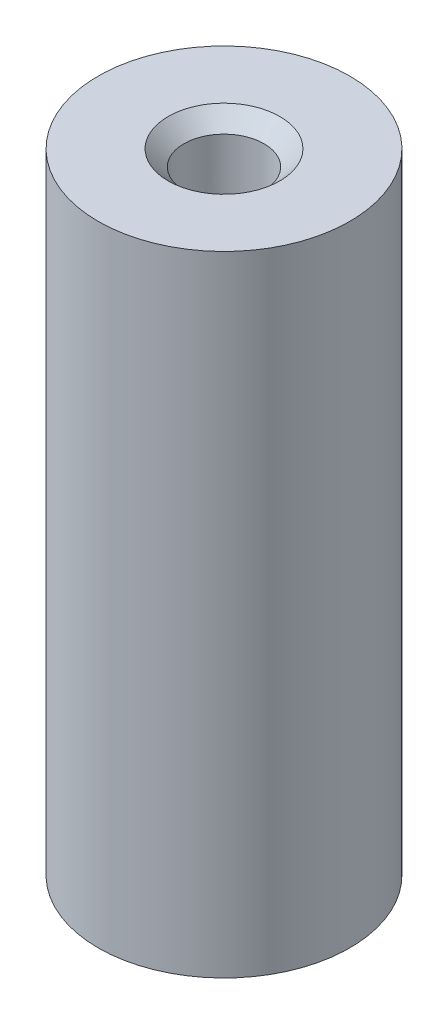
from build123d import *

# Parameters (mm, degrees)
SKETCH1_R           = 4
BOSS_EXTRUDE1_DEPTH = 20
SKETCH2_R           = 2.45
CUT_EXTRUDE1_DEPTH  = 6
SKETCH3_R           = 2.7
CUT_EXTRUDE2_DEPTH  = 10
SKETCH4_R           = 1.275
CUT_EXTRUDE3_DEPTH  = 6
CHAMFER1_SIZE       = 0.5
CHAMFER2_SIZE       = 1.5


with BuildPart() as part:
    # Sketch1 → Boss-Extrude1 (new body)
    with BuildSketch(Plane(origin=(0, 0, 0), x_dir=(1, 0, 0), z_dir=(0, 1, 0))):
        with Locations(Location((0, 0, 0), (0, 0, 270))):
            Circle(SKETCH1_R)
    extrude(amount=BOSS_EXTRUDE1_DEPTH)

    # Sketch2 → Cut-Extrude1 (cut)
    with BuildSketch(Plane.XZ):
        with Locations(Location((0, 0, 0), (0, 0, 270))):
            Circle(SKETCH2_R)
    extrude(amount=-CUT_EXTRUDE1_DEPTH, mode=Mode.SUBTRACT)

    # Sketch3 → Cut-Extrude2 (cut)
    with BuildSketch(Plane.XZ.offset(-6)):
        with Locations(Location((0, 0, 0), (0, 0, 270))):
            Circle(SKETCH3_R)
    extrude(amount=-CUT_EXTRUDE2_DEPTH, mode=Mode.SUBTRACT)

    # Sketch4 → Cut-Extrude3 (cut)
    with BuildSketch(Plane.XZ.offset(-16)):
        with Locations(Location((0, 0, 0), (0, 0, 270))):
            Circle(SKETCH4_R)
    extrude(amount=-CUT_EXTRUDE3_DEPTH, mode=Mode.SUBTRACT)

    # Chamfer1
    # the kernel refuses this chamfer: 0.5 mm, written as the material it takes off along each edge
    with BuildSketch(Plane(origin=(0, 0, 0), x_dir=(0, 0, -1), z_dir=(-1, 0, 0))) as chamfer1_piece_1:
        Polygon((2.45 + CHAMFER1_SIZE, 0), (2.45, -CHAMFER1_SIZE), (2.45, 0), align=None)
    revolve(axis=Axis((0, 0, 0), (0, -1, 0)), mode=Mode.SUBTRACT)
    with BuildSketch(Plane(origin=(0, 6, 0), x_dir=(0, 0, -1), z_dir=(-1, 0, 0))) as chamfer1_piece_2_section:
        Polygon((2.45, CHAMFER1_SIZE), (2.45 + CHAMFER1_SIZE, 0), (2.45, 0), align=None)
    chamfer1_piece_2 = revolve(axis=Axis((0, 6, 0), (0, -1, 0)), mode=Mode.PRIVATE)
    chamfer1_piece_2 = chamfer1_piece_2 & Plane(origin=(0, 5.626269224, 0), x_dir=(0, 0, -1), z_dir=(0, -1, 0)) * Cylinder(2.7, 12, mode=Mode.PRIVATE)
    add(chamfer1_piece_2, mode=Mode.SUBTRACT)
    with BuildSketch(Plane(origin=(0, 20, 0), x_dir=(0, 0, -1), z_dir=(-1, 0, 0))) as chamfer1_piece_3:
        Polygon((1.275 + CHAMFER1_SIZE, 0), (1.275, CHAMFER1_SIZE), (1.275, 0), align=None)
    revolve(axis=Axis((0, 20, 0), (0, -1, 0)), mode=Mode.SUBTRACT)

    # Chamfer2
    # the kernel refuses this chamfer: 1.5 mm, written as the material it takes off along each edge
    with BuildSketch(Plane(origin=(0, 16, 0), x_dir=(0, 0, -1), z_dir=(-1, 0, 0))) as chamfer2_piece_1_section:
        Polygon((1.275, -CHAMFER2_SIZE), (1.275 + CHAMFER2_SIZE, 0), (1.275, 0), align=None)
    chamfer2_piece_1 = revolve(axis=Axis((0, 16, 0), (0, -1, 0)), mode=Mode.PRIVATE)
    chamfer2_piece_1 = chamfer2_piece_1 & Plane(origin=(0, 16.79183668, 0), x_dir=(0, 0, -1), z_dir=(0, -1, 0)) * Cylinder(2.7, 12, mode=Mode.PRIVATE)
    add(chamfer2_piece_1, mode=Mode.SUBTRACT)


solid = part.part
